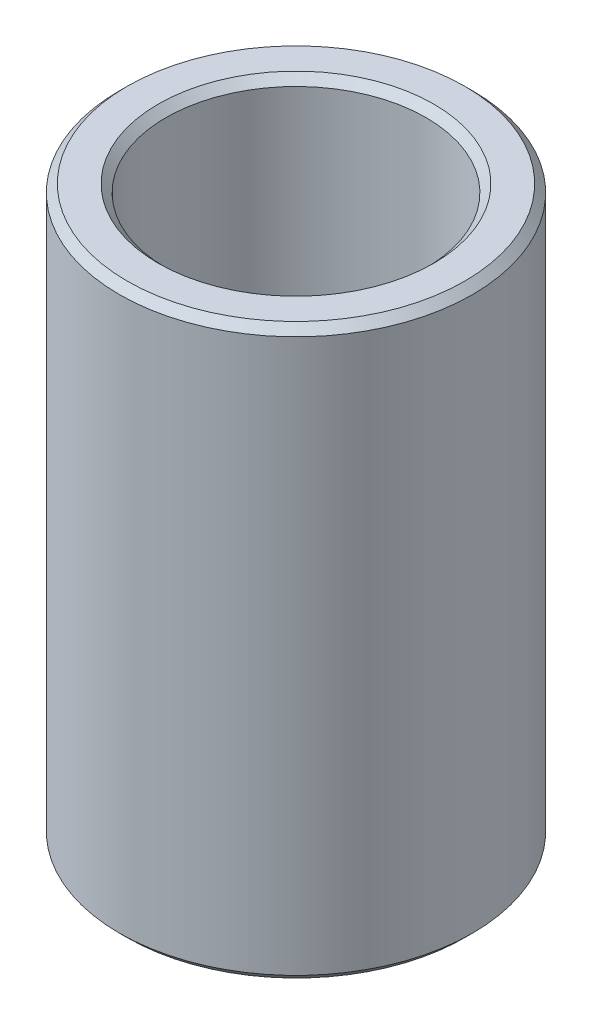
from build123d import *

# Parameters (mm, degrees)
SKETCH1_R           = 57.5
BOSS_EXTRUDE1_DEPTH = 185.184119412
SKETCH2_R           = 42.3590714
CUT_EXTRUDE1_DEPTH  = 203.251472386
CHAMFER1_SIZE       = 2.534587867


with BuildPart() as part:
    # Sketch1 → Boss-Extrude1 (new body)
    with BuildSketch(Plane(origin=(0, 0, 0), x_dir=(1, 0, 0), z_dir=(0, 1, 0))):
        Circle(SKETCH1_R)
    extrude(amount=BOSS_EXTRUDE1_DEPTH)

    # Sketch2 → Cut-Extrude1 (cut, through all)
    with BuildSketch(Plane(origin=(0, 0, 0), x_dir=(1, 0, 0), z_dir=(0, 1, 0))):
        Circle(SKETCH2_R)
    extrude(amount=CUT_EXTRUDE1_DEPTH, mode=Mode.SUBTRACT)

    # Chamfer1
    chamfer1_edges = [part.edges().sort_by_distance(p)[0] for p in [
        (-42.3590714, 185.184119412, 0),
        (-42.3590714, 0, 0),
        (-57.5, 0, 0),
        (-57.5, 185.184119412, 0),
    ]]
    chamfer(chamfer1_edges, length=CHAMFER1_SIZE)


solid = part.part
